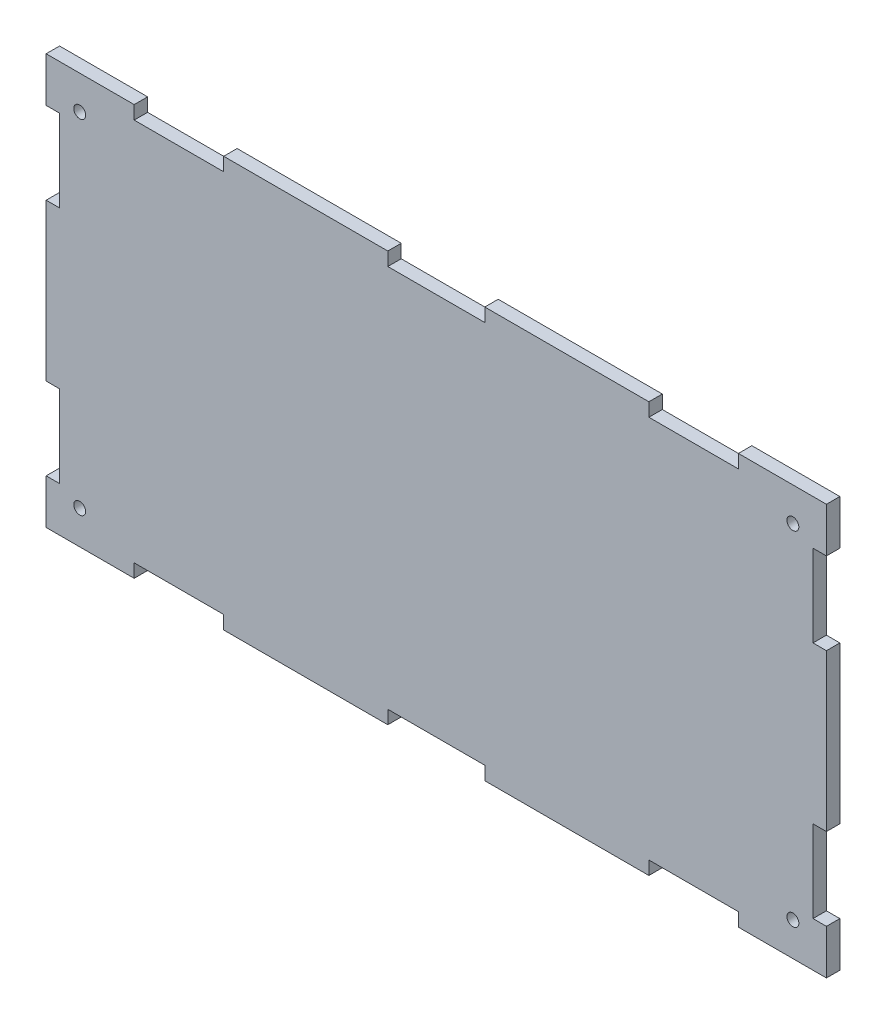
from build123d import *

# Parameters (mm, degrees)
SKETCH_1_W             = 209.2
SKETCH_1_H             = 110
SM_BASE_FLANGE_1_DEPTH = 3.6
CUT_EXTRUDE_1_REACH    = 238.384
SKETCH_2_W             = 3.6
SKETCH_2_H             = 22
SKETCH_2_W_2           = 24
SKETCH_2_H_2           = 3.6
SKETCH_2_W_3           = 26
CUT_EXTRUDE_2_REACH    = 238.384
SKETCH_3_R             = 1.6


# Sheet-metal steps are written as plain solids
with BuildPart() as part:
    # Sketch 1 → Базовая кромка1 (new body)
    with BuildSketch(Plane.XY):
        with Locations((104.6, 55)):
            Rectangle(SKETCH_1_W, SKETCH_1_H)
    extrude(amount=-SM_BASE_FLANGE_1_DEPTH)

    # Sketch 2 → Вырез-Вытянуть1 (cut, up to next)
    with BuildSketch(Plane.XY, mode=Mode.PRIVATE) as cut_extrude_1_sk1:
        with Locations((1.8, 23)):
            Rectangle(SKETCH_2_W, SKETCH_2_H)
    cut_extrude_1_tool1 = extrude(cut_extrude_1_sk1.sketch, amount=-CUT_EXTRUDE_1_REACH, mode=Mode.PRIVATE) & part.part
    # Sketch 2 → Вырез-Вытянуть1 (cut, up to next)
    with BuildSketch(Plane.XY, mode=Mode.PRIVATE) as cut_extrude_1_sk2:
        with Locations((35.6, 1.8)):
            Rectangle(SKETCH_2_W_2, SKETCH_2_H_2)
    cut_extrude_1_tool2 = extrude(cut_extrude_1_sk2.sketch, amount=-CUT_EXTRUDE_1_REACH, mode=Mode.PRIVATE) & part.part
    # Sketch 2 → Вырез-Вытянуть1 (cut, up to next)
    with BuildSketch(Plane.XY, mode=Mode.PRIVATE) as cut_extrude_1_sk3:
        with Locations((207.4, 87)):
            Rectangle(SKETCH_2_W, SKETCH_2_H)
    cut_extrude_1_tool3 = extrude(cut_extrude_1_sk3.sketch, amount=-CUT_EXTRUDE_1_REACH, mode=Mode.PRIVATE) & part.part
    # Sketch 2 → Вырез-Вытянуть1 (cut, up to next)
    with BuildSketch(Plane.XY, mode=Mode.PRIVATE) as cut_extrude_1_sk4:
        with Locations((104.6, 1.8)):
            Rectangle(SKETCH_2_W_3, SKETCH_2_H_2)
    cut_extrude_1_tool4 = extrude(cut_extrude_1_sk4.sketch, amount=-CUT_EXTRUDE_1_REACH, mode=Mode.PRIVATE) & part.part
    # Sketch 2 → Вырез-Вытянуть1 (cut, up to next)
    with BuildSketch(Plane.XY, mode=Mode.PRIVATE) as cut_extrude_1_sk5:
        with Locations((173.6, 1.8)):
            Rectangle(SKETCH_2_W_2, SKETCH_2_H_2)
    cut_extrude_1_tool5 = extrude(cut_extrude_1_sk5.sketch, amount=-CUT_EXTRUDE_1_REACH, mode=Mode.PRIVATE) & part.part
    # Sketch 2 → Вырез-Вытянуть1 (cut, up to next)
    with BuildSketch(Plane.XY, mode=Mode.PRIVATE) as cut_extrude_1_sk6:
        with Locations((207.4, 23)):
            Rectangle(SKETCH_2_W, SKETCH_2_H)
    cut_extrude_1_tool6 = extrude(cut_extrude_1_sk6.sketch, amount=-CUT_EXTRUDE_1_REACH, mode=Mode.PRIVATE) & part.part
    # Sketch 2 → Вырез-Вытянуть1 (cut, up to next)
    with BuildSketch(Plane.XY, mode=Mode.PRIVATE) as cut_extrude_1_sk7:
        with Locations((173.6, 108.2)):
            Rectangle(SKETCH_2_W_2, SKETCH_2_H_2)
    cut_extrude_1_tool7 = extrude(cut_extrude_1_sk7.sketch, amount=-CUT_EXTRUDE_1_REACH, mode=Mode.PRIVATE) & part.part
    # Sketch 2 → Вырез-Вытянуть1 (cut, up to next)
    with BuildSketch(Plane.XY, mode=Mode.PRIVATE) as cut_extrude_1_sk8:
        with Locations((104.6, 108.2)):
            Rectangle(SKETCH_2_W_3, SKETCH_2_H_2)
    cut_extrude_1_tool8 = extrude(cut_extrude_1_sk8.sketch, amount=-CUT_EXTRUDE_1_REACH, mode=Mode.PRIVATE) & part.part
    # Sketch 2 → Вырез-Вытянуть1 (cut, up to next)
    with BuildSketch(Plane.XY, mode=Mode.PRIVATE) as cut_extrude_1_sk9:
        with Locations((35.6, 108.2)):
            Rectangle(SKETCH_2_W_2, SKETCH_2_H_2)
    cut_extrude_1_tool9 = extrude(cut_extrude_1_sk9.sketch, amount=-CUT_EXTRUDE_1_REACH, mode=Mode.PRIVATE) & part.part
    # Sketch 2 → Вырез-Вытянуть1 (cut, up to next)
    with BuildSketch(Plane.XY, mode=Mode.PRIVATE) as cut_extrude_1_sk10:
        with Locations((1.8, 87)):
            Rectangle(SKETCH_2_W, SKETCH_2_H)
    cut_extrude_1_tool10 = extrude(cut_extrude_1_sk10.sketch, amount=-CUT_EXTRUDE_1_REACH, mode=Mode.PRIVATE) & part.part
    add(cut_extrude_1_tool1.solids().sort_by_distance((1.8, 23, 0))[0], mode=Mode.SUBTRACT)
    add(cut_extrude_1_tool2.solids().sort_by_distance((35.6, 1.8, 0))[0], mode=Mode.SUBTRACT)
    add(cut_extrude_1_tool3.solids().sort_by_distance((207.4, 87, 0))[0], mode=Mode.SUBTRACT)
    add(cut_extrude_1_tool4.solids().sort_by_distance((104.6, 1.8, 0))[0], mode=Mode.SUBTRACT)
    add(cut_extrude_1_tool5.solids().sort_by_distance((173.6, 1.8, 0))[0], mode=Mode.SUBTRACT)
    add(cut_extrude_1_tool6.solids().sort_by_distance((207.4, 23, 0))[0], mode=Mode.SUBTRACT)
    add(cut_extrude_1_tool7.solids().sort_by_distance((173.6, 108.2, 0))[0], mode=Mode.SUBTRACT)
    add(cut_extrude_1_tool8.solids().sort_by_distance((104.6, 108.2, 0))[0], mode=Mode.SUBTRACT)
    add(cut_extrude_1_tool9.solids().sort_by_distance((35.6, 108.2, 0))[0], mode=Mode.SUBTRACT)
    add(cut_extrude_1_tool10.solids().sort_by_distance((1.8, 87, 0))[0], mode=Mode.SUBTRACT)

    # Эскиз3 → Вырез-Вытянуть2 (cut, up to next)
    with BuildSketch(Plane(origin=(0, 0, -3.6), x_dir=(-1, 0, 0), z_dir=(0, 0, -1)), mode=Mode.PRIVATE) as cut_extrude_2_sk1:
        with Locations((-9, 9)):
            Circle(SKETCH_3_R)
    cut_extrude_2_tool1 = extrude(cut_extrude_2_sk1.sketch, amount=-CUT_EXTRUDE_2_REACH, mode=Mode.PRIVATE) & part.part
    # Эскиз3 → Вырез-Вытянуть2 (cut, up to next)
    with BuildSketch(Plane(origin=(0, 0, -3.6), x_dir=(-1, 0, 0), z_dir=(0, 0, -1)), mode=Mode.PRIVATE) as cut_extrude_2_sk2:
        with Locations((-9, 101)):
            Circle(SKETCH_3_R)
    cut_extrude_2_tool2 = extrude(cut_extrude_2_sk2.sketch, amount=-CUT_EXTRUDE_2_REACH, mode=Mode.PRIVATE) & part.part
    # Эскиз3 → Вырез-Вытянуть2 (cut, up to next)
    with BuildSketch(Plane(origin=(0, 0, -3.6), x_dir=(-1, 0, 0), z_dir=(0, 0, -1)), mode=Mode.PRIVATE) as cut_extrude_2_sk3:
        with Locations((-200.2, 9)):
            Circle(SKETCH_3_R)
    cut_extrude_2_tool3 = extrude(cut_extrude_2_sk3.sketch, amount=-CUT_EXTRUDE_2_REACH, mode=Mode.PRIVATE) & part.part
    # Эскиз3 → Вырез-Вытянуть2 (cut, up to next)
    with BuildSketch(Plane(origin=(0, 0, -3.6), x_dir=(-1, 0, 0), z_dir=(0, 0, -1)), mode=Mode.PRIVATE) as cut_extrude_2_sk4:
        with Locations((-200.2, 101)):
            Circle(SKETCH_3_R)
    cut_extrude_2_tool4 = extrude(cut_extrude_2_sk4.sketch, amount=-CUT_EXTRUDE_2_REACH, mode=Mode.PRIVATE) & part.part
    add(cut_extrude_2_tool1.solids().sort_by_distance((9, 9, -3.6))[0], mode=Mode.SUBTRACT)
    add(cut_extrude_2_tool2.solids().sort_by_distance((9, 101, -3.6))[0], mode=Mode.SUBTRACT)
    add(cut_extrude_2_tool3.solids().sort_by_distance((200.2, 9, -3.6))[0], mode=Mode.SUBTRACT)
    add(cut_extrude_2_tool4.solids().sort_by_distance((200.2, 101, -3.6))[0], mode=Mode.SUBTRACT)


solid = part.part
